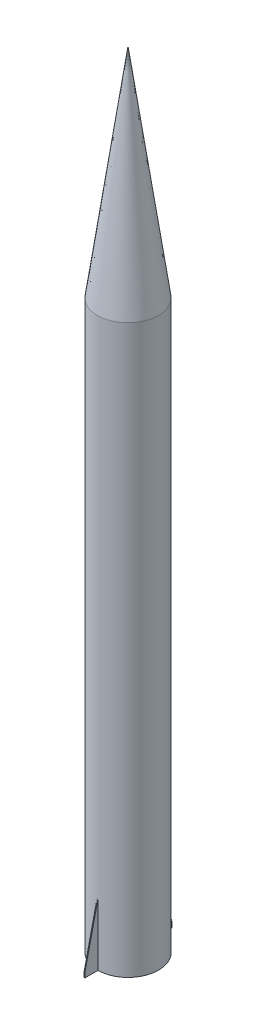
from build123d import *

# Parameters (mm, degrees)
SKETCH1_R           = 350
BOSS_EXTRUDE1_DEPTH = 6500
SKETCH10_R          = 35
CUT_EXTRUDE2_DEPTH  = 100
LPATTERN1_COUNT     = 3
LPATTERN1_PITCH     = 1000


# Read off the part's stored shape, not the designer's step: Loft3
with BuildPart() as part:
    # Sketch1 → Boss-Extrude1 (new body)
    with BuildSketch(Plane(origin=(0, 0, 0), x_dir=(1, 0, 0), z_dir=(0, 1, 0))):
        with Locations(Location((0, 0, 0), (0, 0, 270))):
            Circle(SKETCH1_R)
    extrude(amount=BOSS_EXTRUDE1_DEPTH)

    # Sketch10 → Cut-Extrude2 (cut)
    with BuildSketch(Plane.ZY.offset(350)):
        with Locations((0, 2000)):
            Circle(SKETCH10_R)
    cut_extrude2 = extrude(amount=-CUT_EXTRUDE2_DEPTH, mode=Mode.SUBTRACT)

    # LPattern1: Cut-Extrude2 ×3
    with Locations(*[(0, i * LPATTERN1_PITCH, 0) for i in range(1, LPATTERN1_COUNT)]):
        add(cut_extrude2, mode=Mode.SUBTRACT)

    # Loft3 outline → Loft3 (revolve)
    with BuildSketch(Plane.XY):
        Polygon((350, 6500), (0, 9000), (0, 6500), align=None)
    revolve(axis=Axis((0, 0, 0), (0, 1, 0)))


with BuildPart() as body_2:
    # Sketch6 → Loft2 section 0
    with BuildSketch(Plane(origin=(0, 0, -350), x_dir=(-1, 0, 0), z_dir=(0, 0, -1))):
        with BuildLine():
            Line((-4.859485667, 0), (-4.859485667, 708.11375157))
            Line((-4.859485667, 708.11375157), (5.140514333, 708.11375157))
            Line((5.140514333, 708.11375157), (5.140514333, 0))
            Line((5.140514333, 0), (-4.859485667, 0))
        make_face()
    # Sketch7 → Loft2 section 1
    with BuildSketch(Plane(origin=(0, 0, -500), x_dir=(-1, 0, 0), z_dir=(0, 0, -1))):
        with BuildLine():
            Line((-4.859485667, 0), (-4.859485667, 50))
            Line((-4.859485667, 50), (5.140514333, 50))
            Line((5.140514333, 50), (5.140514333, 0))
            Line((5.140514333, 0), (-4.859485667, 0))
        make_face()
    loft()


with BuildPart() as body_3:
    # Mirror1: mirrored copy
    add(body_2.part.mirror(Plane.XY))


solid = Compound([part.part, body_2.part, body_3.part])
